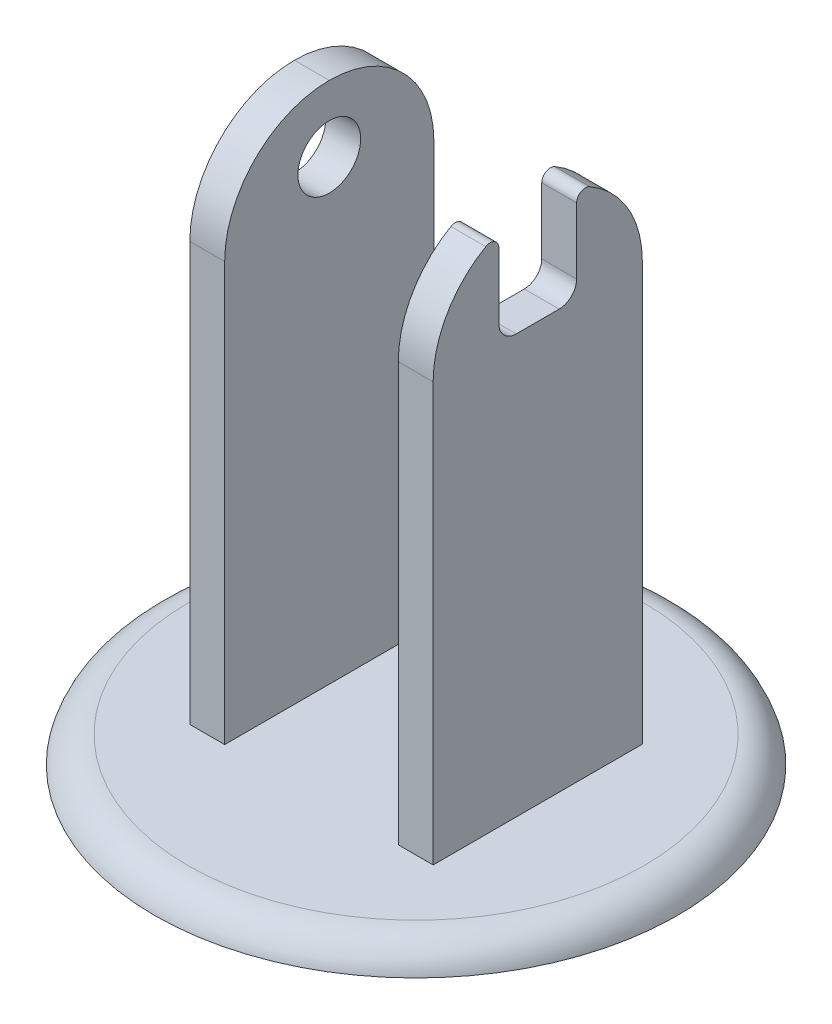
from build123d import *

# Parameters (mm, degrees)
SKETCH1_R           = 50
BOSS_EXTRUDE1_DEPTH = 7.5
SKETCH2_R           = 75
BOSS_EXTRUDE2_DEPTH = 7.5
SKETCH3_W           = 10
SKETCH3_H           = 60
BOSS_EXTRUDE3_DEPTH = 150
FILLET1_R           = 30
FILLET2_R           = 10
CUT_EXTRUDE1_DEPTH  = 10
FILLET3_R           = 2.5
SKETCH5_R           = 9
CUT_EXTRUDE6_DEPTH  = 212.960382158


# Some blends are built 0.0001 mm under size
with BuildPart() as part:
    # Sketch1 → Boss-Extrude1 (new body)
    with BuildSketch(Plane(origin=(0, 0, 0), x_dir=(1, 0, 0), z_dir=(0, 1, 0))):
        with Locations(Location((0, 0, 0), (0, 0, 270))):
            Circle(SKETCH1_R)
    extrude(amount=BOSS_EXTRUDE1_DEPTH)

    # Sketch2 → Boss-Extrude2 (add)
    with BuildSketch(Plane(origin=(0, 7.5, 0), x_dir=(1, 0, 0), z_dir=(0, 1, 0))):
        with Locations(Location((0, 0, 0), (0, 0, 270))):
            Circle(SKETCH2_R)
    extrude(amount=BOSS_EXTRUDE2_DEPTH)

    # Sketch3 → Boss-Extrude3 (add)
    with BuildSketch(Plane(origin=(0, 15, 0), x_dir=(1, 0, 0), z_dir=(0, 1, 0))):
        with Locations((29.896331169, 0)):
            Rectangle(SKETCH3_W, SKETCH3_H)
        with Locations((-29.896331169, 0)):
            Rectangle(SKETCH3_W, SKETCH3_H)
    extrude(amount=BOSS_EXTRUDE3_DEPTH)

    # Fillet1
    fillet1_edges = [part.edges().sort_by_distance(p)[0] for p in [
        (29.896331169, 165, 30),
        (-29.896331169, 165, 30),
        (-29.896331169, 165, -30),
        (29.896331169, 165, -30),
    ]]
    fillet(fillet1_edges, radius=FILLET1_R - 0.0001)  # a hair under: the kernel refuses the full size

    # Fillet2
    # the kernel refuses this fillet: 10 mm, written as the material it takes off along each edge
    with BuildSketch(Plane(origin=(0, 15, 0), x_dir=(0, 0, 1), z_dir=(-1, 0, 0))) as fillet2_piece_1:
        with BuildLine():
            CenterArc((65.317541634, -10), FILLET2_R, 14.477512186, 75.522487814)
            Line((75, -7.5), (75.193649167, -7.45))
            ThreePointArc((75.193649167, -7.45), (75.2, -3.75), (75.2, 0))
            Line((75.2, 0), (75, 0.2))
            Line((75, 0.2), (65.317541634, 0.2))
            Line((65.317541634, 0.2), (65.317541634, 0))
        make_face()
    revolve(axis=Axis((0, 15, 0), (0, 1, 0)), mode=Mode.SUBTRACT)

    # Sketch4 → Cut-Extrude1 (cut)
    with BuildSketch(Plane(origin=(34.896331169, 0, 0), x_dir=(0, 0, -1), z_dir=(1, 0, 0))):
        with BuildLine():
            Line((-11.15, 195), (11.15, 195))
            Line((11.15, 195), (11.15, 140))
            ThreePointArc((11.15, 140), (9.685533906, 136.464466094), (6.15, 135))
            Line((6.15, 135), (-6.15, 135))
            ThreePointArc((-6.15, 135), (-9.685533906, 136.464466094), (-11.15, 140))
            Line((-11.15, 140), (-11.15, 195))
        make_face()
    extrude(amount=-CUT_EXTRUDE1_DEPTH, mode=Mode.SUBTRACT)

    # Fillet3
    fillet3_edges = [part.edges().sort_by_distance(p)[0] for p in [
        (29.896331169, 162.851019733, 11.15),
        (29.896331169, 162.851019733, -11.15),
    ]]
    fillet(fillet3_edges, radius=FILLET3_R)

    # Sketch5 → Cut-Extrude6 (cut, through all)
    with BuildSketch(Plane(origin=(34.896331169, 0, 0), x_dir=(0, 0, -1), z_dir=(1, 0, 0))):
        with Locations((0, 146)):
            Circle(SKETCH5_R)
    extrude(amount=-CUT_EXTRUDE6_DEPTH, mode=Mode.SUBTRACT)


solid = part.part
